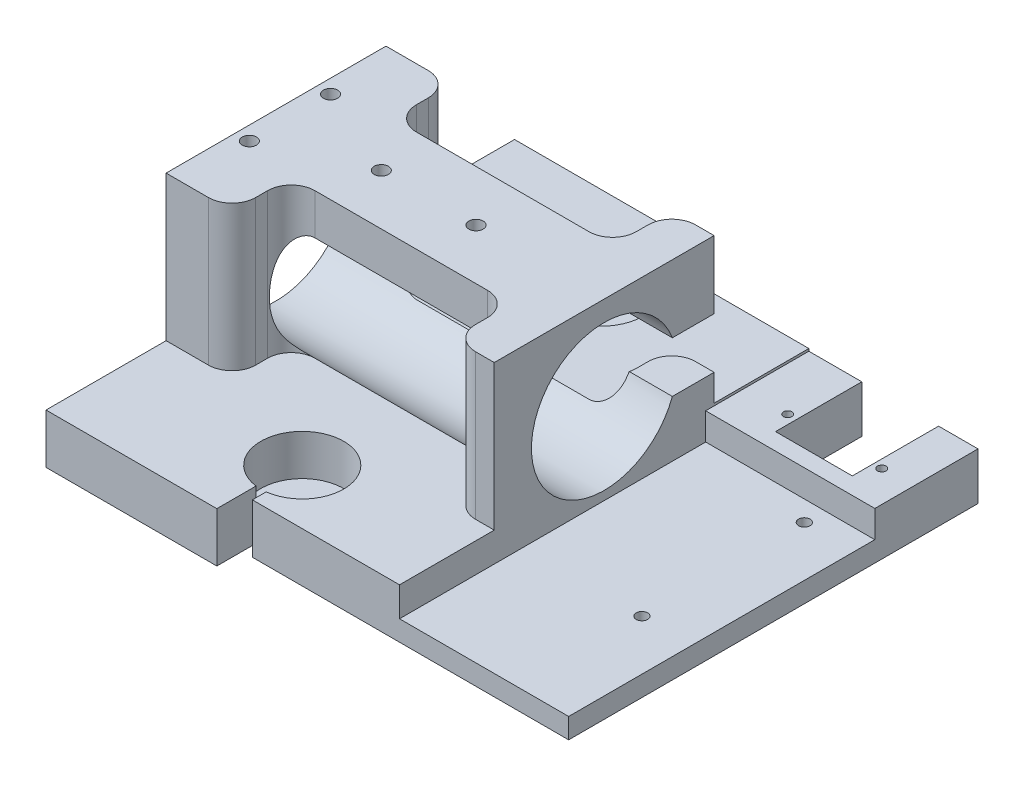
from build123d import *
from build123d.topology import SkipClean

# Parameters (mm, degrees)
SKETCH1_W            = 90
SKETCH1_H            = 65
BOSS_EXTRUDE1_DEPTH  = 55
SKETCH2_R            = 21.5
CUT_EXTRUDE1_DEPTH   = 124.895116934
SKETCH3_W            = 65
SKETCH3_H            = 35
CUT_EXTRUDE2_DEPTH   = 124.895116934
FILLET1_R            = 7
BOSS_EXTRUDE2_START  = -12.097078
BOSS_EXTRUDE2_DEPTH  = 12.097078
SKETCH5_R            = 12.25
CUT_EXTRUDE3_DEPTH   = 12.5
SKETCH6_W            = 90
SKETCH6_H            = 121
BOSS_EXTRUDE3_DEPTH  = 3
CUT_EXTRUDE4_DEPTH   = 7.5
SKETCH8_W            = 50
SKETCH8_H            = 36
BOSS_EXTRUDE4_DEPTH  = 14.397078199
SKETCH9_R            = 1.25
SKETCH9_W            = 22.7
SKETCH9_H            = 12.5
CUT_EXTRUDE5_DEPTH   = 174.638172066
CUT_EXTRUDE6_DEPTH   = 0.2
SKETCH11_R           = 21.5
BOSS_EXTRUDE5_DEPTH  = 7
CUT_EXTRUDE7_DEPTH   = 3
SKETCH13_W           = 50
SKETCH13_H           = 14.897078199
BOSS_EXTRUDE6_DEPTH  = 10
SKETCH14_R           = 2.1
CUT_EXTRUDE8_DEPTH   = 4.2
SKETCH17_R           = 2.1
CUT_EXTRUDE10_DEPTH  = 4.2
CUT_EXTRUDE11_DEPTH  = 0.2
SKETCH19_W           = 50
SKETCH19_H           = 35.792399942
CUT_EXTRUDE12_DEPTH  = 0.2
SKETCH20_W           = 50
SKETCH20_H           = 13.797078199
CUT_EXTRUDE13_DEPTH  = 4
CUT_EXTRUDE14_DEPTH  = 180.024190286
SKETCH22_R           = 3.15
CUT_EXTRUDE15_DEPTH  = 183.301947359
CUT_EXTRUDE16_START  = -7
SKETCH23_W           = 50
SKETCH23_H           = 31.792399942
SKETCH23_R           = 1.25
SKETCH23_W_2         = 22.7
SKETCH23_H_2         = 12.5
CUT_EXTRUDE16_DEPTH  = 7
SKETCH24_W           = 50
SKETCH24_H           = 7.2
CUT_EXTRUDE17_DEPTH  = 193.913980558
BOSS_EXTRUDE7_DEPTH  = 0.3
SKETCH26_W           = 50.5
SKETCH26_H           = 14.697078199
BOSS_EXTRUDE8_DEPTH  = 7.5
CUT_EXTRUDE18_DEPTH  = 2.5
SKETCH32_W           = 50
SKETCH32_H           = 89
BOSS_EXTRUDE19_DEPTH = 6
CUT_EXTRUDE20_DEPTH  = 2.5
SKETCH35_R           = 1.7
CUT_EXTRUDE21_DEPTH  = 184.103140365
SKETCH36_W           = 50
SKETCH36_H           = 32
BOSS_EXTRUDE21_DEPTH = 7.2
SKETCH37_W           = 22.7
SKETCH37_H           = 25.5
CUT_EXTRUDE22_DEPTH  = 180.193233126
SKETCH38_R           = 1.25
CUT_EXTRUDE23_DEPTH  = 180.193233126
SKETCH39_W           = 50
SKETCH39_H           = 1.5
CUT_EXTRUDE24_DEPTH  = 7.997078199


with BuildPart() as part:
    # Sketch1 → Boss-Extrude1 (new body)
    with BuildSketch(Plane(origin=(0, 0, 0), x_dir=(1, 0, 0), z_dir=(0, 1, 0))):
        with Locations((45, 32.5)):
            Rectangle(SKETCH1_W, SKETCH1_H)
    extrude(amount=BOSS_EXTRUDE1_DEPTH)

    # Sketch2 → Cut-Extrude1 (cut, through all)
    with BuildSketch(Plane(origin=(90, 0, 0), x_dir=(0, 0, -1), z_dir=(1, 0, 0))):
        with Locations((32.5, 27.5)):
            Circle(SKETCH2_R)
    extrude(amount=-CUT_EXTRUDE1_DEPTH, mode=Mode.SUBTRACT)

    # Sketch3 → Cut-Extrude2 (cut, through all)
    with BuildSketch(Plane(origin=(0, 55, 0), x_dir=(1, 0, 0), z_dir=(0, 1, 0))):
        with Locations((45, 0)):
            Rectangle(SKETCH3_W, SKETCH3_H)
    cut_extrude2 = extrude(amount=-CUT_EXTRUDE2_DEPTH, mode=Mode.SUBTRACT)

    # Mirror1: Cut-Extrude2 across plane
    add(cut_extrude2.mirror(Plane.XY.offset(-32.5)), mode=Mode.SUBTRACT)

    # Fillet1
    # the kernel refuses this fillet: 7 mm, written as the material it adds along each edge
    with BuildSketch(Plane(origin=(77.5, 29.597078199, -17.5), x_dir=(0, 0, 1), z_dir=(0, -1, 0))) as fillet1_piece_1_section:
        with BuildLine():
            CenterArc((FILLET1_R, FILLET1_R), FILLET1_R, 180, 90)
            Line((0, FILLET1_R), (0, 0))
            Line((0, 0), (FILLET1_R, 0))
        make_face()
    fillet1_piece_1 = extrude(amount=29.597078199, mode=Mode.PRIVATE)
    fillet1_piece_1 = fillet1_piece_1 - Plane(origin=(76.052033845, 27.5, -32.5), x_dir=(0, 0, -1), z_dir=(1, 0, 0)) * Cylinder(21.5, 88, mode=Mode.PRIVATE)
    add(fillet1_piece_1)
    with BuildSketch(Plane(origin=(77.5, 55, -17.5), x_dir=(0, 0, 1), z_dir=(0, -1, 0))) as fillet1_piece_2_section:
        with BuildLine():
            CenterArc((FILLET1_R, FILLET1_R), FILLET1_R, 180, 90)
            Line((0, FILLET1_R), (0, 0))
            Line((0, 0), (FILLET1_R, 0))
        make_face()
    fillet1_piece_2 = extrude(amount=29.597078199, mode=Mode.PRIVATE)
    fillet1_piece_2 = fillet1_piece_2 - Plane(origin=(76.052033717, 27.5, -32.5), x_dir=(0, 0, -1), z_dir=(1, 0, 0)) * Cylinder(21.5, 88, mode=Mode.PRIVATE)
    add(fillet1_piece_2)
    with BuildSketch(Plane(origin=(12.5, 55, -17.5), x_dir=(0, 0, 1), z_dir=(0, -1, 0))) as fillet1_piece_3_section:
        with BuildLine():
            CenterArc((FILLET1_R, -FILLET1_R), FILLET1_R, 90, 90)
            Line((0, -FILLET1_R), (0, 0))
            Line((0, 0), (FILLET1_R, 0))
        make_face()
    fillet1_piece_3 = extrude(amount=29.597078199, mode=Mode.PRIVATE)
    fillet1_piece_3 = fillet1_piece_3 - Plane(origin=(13.947966283, 27.5, -32.5), x_dir=(0, 0, -1), z_dir=(1, 0, 0)) * Cylinder(21.5, 88, mode=Mode.PRIVATE)
    add(fillet1_piece_3)
    with BuildSketch(Plane(origin=(12.5, 29.597078199, -17.5), x_dir=(0, 0, 1), z_dir=(0, -1, 0))) as fillet1_piece_4_section:
        with BuildLine():
            CenterArc((FILLET1_R, -FILLET1_R), FILLET1_R, 90, 90)
            Line((0, -FILLET1_R), (0, 0))
            Line((0, 0), (FILLET1_R, 0))
        make_face()
    fillet1_piece_4 = extrude(amount=29.597078199, mode=Mode.PRIVATE)
    fillet1_piece_4 = fillet1_piece_4 - Plane(origin=(13.947966155, 27.5, -32.5), x_dir=(0, 0, -1), z_dir=(1, 0, 0)) * Cylinder(21.5, 88, mode=Mode.PRIVATE)
    add(fillet1_piece_4)
    with BuildSketch(Plane(origin=(77.5, 55, -47.5), x_dir=(0, 0, -1), z_dir=(0, -1, 0))) as fillet1_piece_5_section:
        with BuildLine():
            CenterArc((FILLET1_R, -FILLET1_R), FILLET1_R, 90, 90)
            Line((0, -FILLET1_R), (0, 0))
            Line((0, 0), (FILLET1_R, 0))
        make_face()
    fillet1_piece_5 = extrude(amount=29.597078199, mode=Mode.PRIVATE)
    fillet1_piece_5 = fillet1_piece_5 - Plane(origin=(76.052033717, 27.5, -32.5), x_dir=(0, 0, -1), z_dir=(1, 0, 0)) * Cylinder(21.5, 88, mode=Mode.PRIVATE)
    add(fillet1_piece_5)
    with BuildSketch(Plane(origin=(77.5, 29.597078199, -47.5), x_dir=(-1, 0, 0), z_dir=(0, -1, 0))) as fillet1_piece_6_section:
        with BuildLine():
            CenterArc((FILLET1_R, FILLET1_R), FILLET1_R, 180, 90)
            Line((0, FILLET1_R), (0, 0))
            Line((0, 0), (FILLET1_R, 0))
        make_face()
    fillet1_piece_6 = extrude(amount=29.597078199, mode=Mode.PRIVATE)
    fillet1_piece_6 = fillet1_piece_6 - Plane(origin=(76.052035002, 27.5, -32.5), x_dir=(0, 0, -1), z_dir=(1, 0, 0)) * Cylinder(21.5, 88, mode=Mode.PRIVATE)
    add(fillet1_piece_6)
    with BuildSketch(Plane(origin=(12.5, 29.597078199, -47.5), x_dir=(0, 0, -1), z_dir=(0, -1, 0))) as fillet1_piece_7_section:
        with BuildLine():
            CenterArc((FILLET1_R, FILLET1_R), FILLET1_R, 180, 90)
            Line((0, FILLET1_R), (0, 0))
            Line((0, 0), (FILLET1_R, 0))
        make_face()
    fillet1_piece_7 = extrude(amount=29.597078199, mode=Mode.PRIVATE)
    fillet1_piece_7 = fillet1_piece_7 - Plane(origin=(13.947966038, 27.5, -32.5), x_dir=(0, 0, -1), z_dir=(1, 0, 0)) * Cylinder(21.5, 88, mode=Mode.PRIVATE)
    add(fillet1_piece_7)
    with BuildSketch(Plane(origin=(12.5, 55, -47.5), x_dir=(0, 0, -1), z_dir=(0, -1, 0))) as fillet1_piece_8_section:
        with BuildLine():
            CenterArc((FILLET1_R, FILLET1_R), FILLET1_R, 180, 90)
            Line((0, FILLET1_R), (0, 0))
            Line((0, 0), (FILLET1_R, 0))
        make_face()
    fillet1_piece_8 = extrude(amount=29.597078199, mode=Mode.PRIVATE)
    fillet1_piece_8 = fillet1_piece_8 - Plane(origin=(13.947966283, 27.5, -32.5), x_dir=(0, 0, -1), z_dir=(1, 0, 0)) * Cylinder(21.5, 88, mode=Mode.PRIVATE)
    add(fillet1_piece_8)
    # the kernel refuses this fillet: 7 mm, written as the material it takes off along each edge
    with BuildSketch(Plane(origin=(77.5, 72.5, 0), x_dir=(0, 0, -1), z_dir=(0, -1, 0)), Plane(origin=(77.5, 72.5, -65), x_dir=(1, 0, 0), z_dir=(0, -1, 0))) as fillet1_2_piece_1:
        with BuildLine():
            CenterArc((FILLET1_R, FILLET1_R), FILLET1_R, 180, 90)
            Line((0, FILLET1_R), (0, 0))
            Line((0, 0), (FILLET1_R, 0))
        make_face()
    extrude(amount=90, mode=Mode.SUBTRACT)
    with BuildSketch(Plane(origin=(12.5, -17.5, 0), x_dir=(-1, 0, 0), z_dir=(0, 1, 0)), Plane(origin=(12.5, -17.5, -65), x_dir=(0, 0, 1), z_dir=(0, 1, 0))) as fillet1_2_piece_2:
        with BuildLine():
            CenterArc((FILLET1_R, -FILLET1_R), FILLET1_R, 90, 90)
            Line((0, -FILLET1_R), (0, 0))
            Line((0, 0), (FILLET1_R, 0))
        make_face()
    extrude(amount=90, mode=Mode.SUBTRACT)

    # Sketch4 → Boss-Extrude2 (add)
    with BuildSketch(Plane.XZ.offset(BOSS_EXTRUDE2_START)):
        with BuildLine():
            Line((84.5, 0), (5.5, 0))
            ThreePointArc((5.5, 0), (10.449747468, -2.050252532), (12.5, -7))
            Line((12.5, -7), (12.5, -10.5))
            ThreePointArc((12.5, -10.5), (14.550252532, -15.449747468), (19.5, -17.5))
            Line((19.5, -17.5), (70.5, -17.5))
            ThreePointArc((70.5, -17.5), (75.449747468, -15.449747468), (77.5, -10.5))
            Line((77.5, -10.5), (77.5, -7))
            ThreePointArc((77.5, -7), (79.550252532, -2.050252532), (84.5, 0))
        make_face()
        Polygon((0, 28), (0, 0), (5.5, 0), (84.5, 0), (90, 0), (90, 28), align=None)
        with BuildLine():
            ThreePointArc((12.5, -58), (10.449747468, -62.949747468), (5.5, -65))
            Line((5.5, -65), (84.5, -65))
            ThreePointArc((84.5, -65), (79.550252532, -62.949747468), (77.5, -58))
            Line((77.5, -58), (77.5, -54.5))
            ThreePointArc((77.5, -54.5), (75.449747468, -49.550252532), (70.5, -47.5))
            Line((70.5, -47.5), (19.5, -47.5))
            ThreePointArc((19.5, -47.5), (14.550252532, -49.550252532), (12.5, -54.5))
            Line((12.5, -54.5), (12.5, -58))
        make_face()
        Polygon((5.5, -65), (0, -65), (0, -93), (90, -93), (90, -65), (84.5, -65), align=None)
    extrude(amount=BOSS_EXTRUDE2_DEPTH)

    # Sketch5 → Cut-Extrude3 (cut)
    with BuildSketch(Plane(origin=(0, 0, 0), x_dir=(-1, 0, 0), z_dir=(0, -1, 0))):
        with Locations(Location((-45, 76.75, 0), (0, 0, 90))):
            Circle(SKETCH5_R)
        with Locations(Location((-45, -11.75, 0), (0, 0, 90))):
            Circle(SKETCH5_R)
    extrude(amount=-CUT_EXTRUDE3_DEPTH, mode=Mode.SUBTRACT)

    # Sketch6 → Boss-Extrude3 (add)
    with BuildSketch(Plane.XZ):
        with Locations((45, -32.5)):
            Rectangle(SKETCH6_W, SKETCH6_H)
    extrude(amount=BOSS_EXTRUDE3_DEPTH)

    # Sketch7 → Cut-Extrude4 (cut, symmetric)
    with BuildSketch(Plane(origin=(0, 27.5, 0), x_dir=(-1, 0, 0), z_dir=(0, -1, 0))):
        with BuildLine():
            ThreePointArc((-77.5, 54.5), (-75.449747468, 49.550252532), (-70.5, 47.5))
            Line((-70.5, 47.5), (-70.5, 32.5))
            Line((-70.5, 32.5), (-90, 32.5))
            Line((-90, 32.5), (-90, 65))
            Line((-90, 65), (-84.5, 65))
            ThreePointArc((-84.5, 65), (-79.550252532, 62.949747468), (-77.5, 58))
            Line((-77.5, 58), (-77.5, 54.5))
        make_face()
    extrude(amount=CUT_EXTRUDE4_DEPTH, both=True, mode=Mode.SUBTRACT)

    # Sketch8 → Boss-Extrude4 (add)
    with BuildSketch(Plane.XZ.offset(3)):
        with Locations((115, -75)):
            Rectangle(SKETCH8_W, SKETCH8_H)
    extrude(amount=-BOSS_EXTRUDE4_DEPTH)

    # Sketch9 → Cut-Extrude5 (cut, through all)
    with BuildSketch(Plane(origin=(0, 11.397078199, 0), x_dir=(1, 0, 0), z_dir=(0, 1, 0))):
        with Locations(Location((103, 73.75, 0), (0, 0, 270))):
            Circle(SKETCH9_R)
        with Locations(Location((130.8, 73.75, 0), (0, 0, 270))):
            Circle(SKETCH9_R)
        with Locations((117, 73.75)):
            Rectangle(SKETCH9_W, SKETCH9_H)
    extrude(amount=-CUT_EXTRUDE5_DEPTH, mode=Mode.SUBTRACT)

    # Sketch10 → Cut-Extrude6 (cut)
    with BuildSketch(Plane.XZ.offset(3)):
        Polygon((90, 28), (0, 28), (0, -93), (140, -93), (140, -57), (90, -57), align=None)
    extrude(amount=-CUT_EXTRUDE6_DEPTH, mode=Mode.SUBTRACT)

    # Sketch11 → Boss-Extrude5 (add)
    with SkipClean():  # the faces are left unmerged after this step: merging them gives an invalid solid
        with BuildSketch(Plane.ZY):
            Polygon((-93, -2.8), (28, -2.8), (28, 12.097078199), (0, 12.097078199), (0, 55), (-65, 55), (-65, 12.097078199), (-93, 12.097078199), align=None)
            with Locations(Location((-32.5, 27.5, 0), (0, 0, 159.583789871))):
                Circle(SKETCH11_R, mode=Mode.SUBTRACT)
        extrude(amount=BOSS_EXTRUDE5_DEPTH)

    # Sketch12 → Cut-Extrude7 (cut)
    with SkipClean():  # the faces are left unmerged after this step: merging them gives an invalid solid
        with BuildSketch(Plane.XZ.offset(2.8)):
            Polygon((-1.256860279, -59.25), (0.330852961, -56.5), (-1.256860279, -53.75), (-4.43228676, -53.75), (-6.02, -56.5), (-4.43228676, -59.25), align=None)
        extrude(amount=-CUT_EXTRUDE7_DEPTH, mode=Mode.SUBTRACT)

    # Sketch13 → Boss-Extrude6 (add)
    with SkipClean():  # the faces are left unmerged after this step: merging them gives an invalid solid
        with BuildSketch(Plane(origin=(0, 0, -93), x_dir=(-1, 0, 0), z_dir=(0, 0, -1))):
            with Locations((-18, 4.648539099)):
                Rectangle(SKETCH13_W, SKETCH13_H)
        extrude(amount=BOSS_EXTRUDE6_DEPTH)

    # Sketch14 → Cut-Extrude8 (cut)
    with SkipClean():  # the faces are left unmerged after this step: merging them gives an invalid solid
        with BuildSketch(Plane(origin=(0, 55, 0), x_dir=(1, 0, 0), z_dir=(0, 1, 0))):
            with Locations(Location((-2.89, 44.5, 0), (0, 0, 270))):
                Circle(SKETCH14_R)
            with Locations(Location((-2.89, 20.5, 0), (0, 0, 270))):
                Circle(SKETCH14_R)
        extrude(amount=-CUT_EXTRUDE8_DEPTH, mode=Mode.SUBTRACT)

    # Sketch17 → Cut-Extrude10 (cut)
    with SkipClean():  # the faces are left unmerged after this step: merging them gives an invalid solid
        with BuildSketch(Plane(origin=(0, 55, 0), x_dir=(1, 0, 0), z_dir=(0, 1, 0))):
            with Locations(Location((24.11, 32.5, 0), (0, 0, 270))):
                Circle(SKETCH17_R)
            with Locations(Location((52.11, 32.5, 0), (0, 0, 270))):
                Circle(SKETCH17_R)
        extrude(amount=-CUT_EXTRUDE10_DEPTH, mode=Mode.SUBTRACT)

    # Sketch18 → Cut-Extrude11 (cut)
    with SkipClean():  # the faces are left unmerged after this step: merging them gives an invalid solid
        with BuildSketch(Plane.XZ.offset(2.8)):
            Polygon((90, -57), (90, 28), (-7, 28), (-7, -103), (43, -103), (43, -93), (140, -93), (140, -57), align=None)
        extrude(amount=-CUT_EXTRUDE11_DEPTH, mode=Mode.SUBTRACT)

    # Sketch19 → Cut-Extrude12 (cut)
    with SkipClean():  # the faces are left unmerged after this step: merging them gives an invalid solid
        with BuildSketch(Plane.XZ.offset(2.6)):
            with Locations((115, -74.896199971)):
                Rectangle(SKETCH19_W, SKETCH19_H)
        extrude(amount=-CUT_EXTRUDE12_DEPTH, mode=Mode.SUBTRACT)

    # Sketch20 → Cut-Extrude13 (cut)
    with SkipClean():  # the faces are left unmerged after this step: merging them gives an invalid solid
        with BuildSketch(Plane.XY.offset(-57)):
            with Locations((115, 4.4985391)):
                Rectangle(SKETCH20_W, SKETCH20_H)
        extrude(amount=-CUT_EXTRUDE13_DEPTH, mode=Mode.SUBTRACT)

    # Sketch21 → Cut-Extrude14 (cut, through all)
    with SkipClean():  # the faces are left unmerged after this step: merging them gives an invalid solid
        with BuildSketch(Plane(origin=(0, 12.097078199, 0), x_dir=(1, 0, 0), z_dir=(0, 1, 0))):
            with BuildLine():
                ThreePointArc((46.5, -23.907816416), (45.751414967, -23.976932385), (45, -24))
                Line((45, -24), (45, -28))
                Line((45, -28), (46.5, -28))
                Line((46.5, -28), (46.5, -23.907816416))
            make_face()
            with BuildLine():
                Line((45, -28), (45, -24))
                ThreePointArc((45, -24), (44.248585033, -23.976932385), (43.5, -23.907816416))
                Line((43.5, -23.907816416), (43.5, -28))
                Line((43.5, -28), (45, -28))
            make_face()
        cut_extrude14 = extrude(amount=-CUT_EXTRUDE14_DEPTH, mode=Mode.SUBTRACT)

    # Mirror2: Cut-Extrude14 across plane
    with SkipClean():  # the faces are left unmerged after this step: merging them gives an invalid solid
        add(cut_extrude14.mirror(Plane.XY.offset(-32.5)), mode=Mode.SUBTRACT)

    # Sketch22 → Cut-Extrude15 (cut, through all)
    with SkipClean():  # the faces are left unmerged after this step: merging them gives an invalid solid
        with BuildSketch(Plane(origin=(0, 0, 0), x_dir=(1, 0, 0), z_dir=(0, 1, 0))):
            with Locations(Location((45, -11.75, 0), (0, 0, 270))):
                Circle(SKETCH22_R)
            with Locations(Location((45, 76.75, 0), (0, 0, 270))):
                Circle(SKETCH22_R)
        extrude(amount=-CUT_EXTRUDE15_DEPTH, mode=Mode.SUBTRACT)

    # Sketch23 → Cut-Extrude16 (cut)
    with SkipClean():  # the faces are left unmerged after this step: merging them gives an invalid solid
        with BuildSketch(Plane.XZ.offset(2.4).offset(CUT_EXTRUDE16_START)):
            with Locations((115, -76.896199971)):
                Rectangle(SKETCH23_W, SKETCH23_H)
            with Locations(Location((130.8, -73.75, 0), (0, 0, 90))):
                Circle(SKETCH23_R, mode=Mode.SUBTRACT)
            with Locations(Location((103, -73.75, 0), (0, 0, 90))):
                Circle(SKETCH23_R, mode=Mode.SUBTRACT)
            with Locations((117, -73.75)):
                Rectangle(SKETCH23_W_2, SKETCH23_H_2, mode=Mode.SUBTRACT)
        extrude(amount=CUT_EXTRUDE16_DEPTH, mode=Mode.SUBTRACT)

    # Sketch24 → Cut-Extrude17 (cut, through all)
    with SkipClean():  # the faces are left unmerged after this step: merging them gives an invalid solid
        with BuildSketch(Plane.XY.offset(-92.792399942)):
            with Locations((115, 1)):
                Rectangle(SKETCH24_W, SKETCH24_H)
        extrude(amount=-CUT_EXTRUDE17_DEPTH, mode=Mode.SUBTRACT)

    # Sketch25 → Boss-Extrude7 (add)
    with SkipClean():  # the faces are left unmerged after this step: merging them gives an invalid solid
        with BuildSketch(Plane.XZ.offset(-0.2)):
            Polygon((-4.43228676, -59.25), (-1.256860279, -59.25), (0.330852961, -56.5), (-1.256860279, -53.75), (-4.43228676, -53.75), (-6.02, -56.5), align=None)
        extrude(amount=BOSS_EXTRUDE7_DEPTH)

    # Sketch26 → Boss-Extrude8 (add)
    with SkipClean():  # the faces are left unmerged after this step: merging them gives an invalid solid
        with BuildSketch(Plane.XY.offset(28)):
            with Locations((18.25, 4.7485391)):
                Rectangle(SKETCH26_W, SKETCH26_H)
        extrude(amount=BOSS_EXTRUDE8_DEPTH)

    # Sketch27 → Cut-Extrude18 (cut)
    with SkipClean():  # the faces are left unmerged after this step: merging them gives an invalid solid
        with BuildSketch(Plane.XZ.offset(2.6)):
            Polygon((37.11, 34.64), (34.36, 33.05228676), (34.36, 29.876860279), (37.11, 28.289147039), (39.86, 29.876860279), (39.86, 33.05228676), align=None)
        extrude(amount=-CUT_EXTRUDE18_DEPTH, mode=Mode.SUBTRACT)

    # Sketch32 → Boss-Extrude19 (add)
    with SkipClean():  # the faces are left unmerged after this step: merging them gives an invalid solid
        with BuildSketch(Plane.XZ.offset(2.6)):
            with Locations((115, -16.5)):
                Rectangle(SKETCH32_W, SKETCH32_H)
        extrude(amount=-BOSS_EXTRUDE19_DEPTH)

    # Sketch34 → Cut-Extrude20 (cut)
    with SkipClean():  # the faces are left unmerged after this step: merging them gives an invalid solid
        with BuildSketch(Plane.XZ.offset(2.6)):
            Polygon((128.330852961, -56.5), (126.743139721, -53.75), (123.56771324, -53.75), (121.98, -56.5), (123.56771324, -59.25), (126.743139721, -59.25), align=None)
            Polygon((128.330852961, -8.5), (126.743139721, -5.75), (123.56771324, -5.75), (121.98, -8.5), (123.56771324, -11.25), (126.743139721, -11.25), align=None)
        extrude(amount=-CUT_EXTRUDE20_DEPTH, mode=Mode.SUBTRACT)

    # Sketch35 → Cut-Extrude21 (cut, through all)
    with SkipClean():  # the faces are left unmerged after this step: merging them gives an invalid solid
        with BuildSketch(Plane.XZ.offset(2.6)):
            with Locations(Location((125.155426481, -56.5, 0), (0, 0, 270))):
                Circle(SKETCH35_R)
            with Locations(Location((125.155426481, -8.5, 0), (0, 0, 270))):
                Circle(SKETCH35_R)
        extrude(amount=-CUT_EXTRUDE21_DEPTH, mode=Mode.SUBTRACT)

    # Sketch36 → Boss-Extrude21 (add)
    with SkipClean():  # the faces are left unmerged after this step: merging them gives an invalid solid
        with BuildSketch(Plane.XZ.offset(-4.6)):
            with Locations((115, -77)):
                Rectangle(SKETCH36_W, SKETCH36_H)
        extrude(amount=BOSS_EXTRUDE21_DEPTH)

    # Sketch37 → Cut-Extrude22 (cut, through all)
    with SkipClean():  # the faces are left unmerged after this step: merging them gives an invalid solid
        with BuildSketch(Plane(origin=(0, 11.397078199, 0), x_dir=(1, 0, 0), z_dir=(0, 1, 0))):
            with Locations((117, 80.25)):
                Rectangle(SKETCH37_W, SKETCH37_H)
        extrude(amount=-CUT_EXTRUDE22_DEPTH, mode=Mode.SUBTRACT)

    # Sketch38 → Cut-Extrude23 (cut, through all)
    with SkipClean():  # the faces are left unmerged after this step: merging them gives an invalid solid
        with BuildSketch(Plane(origin=(0, 11.397078199, 0), x_dir=(1, 0, 0), z_dir=(0, 1, 0))):
            with Locations(Location((130.8, 73.75, 0), (0, 0, 270))):
                Circle(SKETCH38_R)
            with Locations(Location((103, 73.75, 0), (0, 0, 270))):
                Circle(SKETCH38_R)
        extrude(amount=-CUT_EXTRUDE23_DEPTH, mode=Mode.SUBTRACT)

    # Sketch39 → Cut-Extrude24 (cut)
    with SkipClean():  # the faces are left unmerged after this step: merging them gives an invalid solid
        with BuildSketch(Plane(origin=(0, 11.397078199, 0), x_dir=(1, 0, 0), z_dir=(0, 1, 0))):
            with Locations((115, 61.75)):
                Rectangle(SKETCH39_W, SKETCH39_H)
        extrude(amount=-CUT_EXTRUDE24_DEPTH, mode=Mode.SUBTRACT)


solid = part.part
